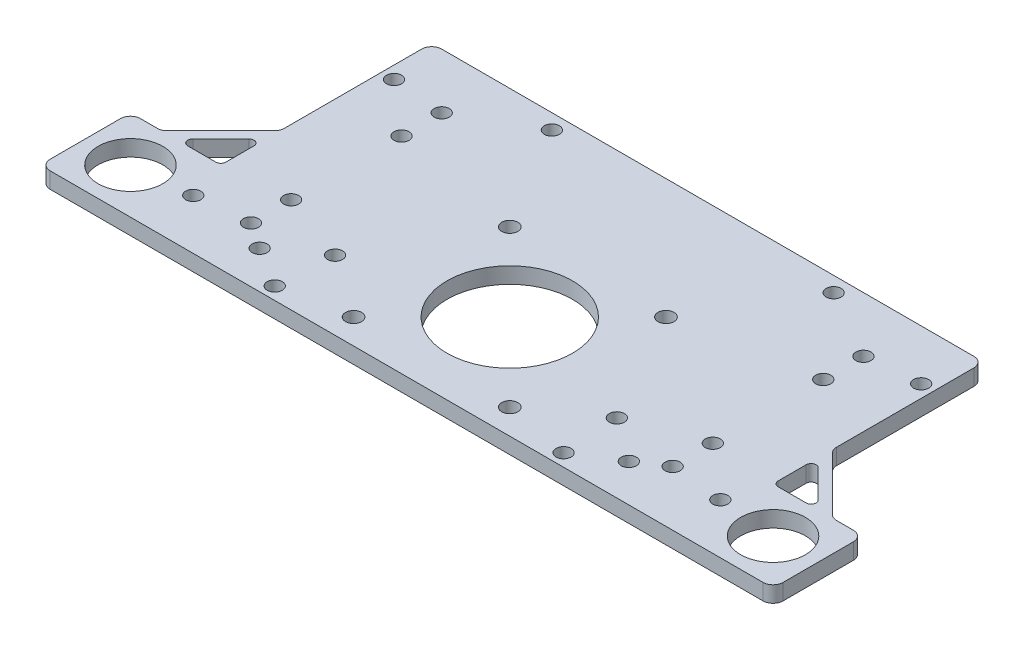
from build123d import *

# Parameters (mm, degrees)
EXTRUDE_1_DEPTH     = 3.2
SKETCH_2_R          = 12.5
SKETCH_2_R_2        = 1.6
SKETCH_2_R_3        = 1.5
SKETCH_2_R_4        = 6.45
CUT_EXTRUDE_1_DEPTH = 3.2
FILLET_1_R          = 2
FILLET_2_R          = 1


# Read off the part's stored shape, not the designer's step: 凸台-拉伸1
with BuildPart() as part:
    # 凸台-拉伸1 outline → 凸台-拉伸1 (new body)
    with BuildSketch(Plane(origin=(0, 0, 0), x_dir=(1, 0, 0), z_dir=(0, 1, 0))):
        Polygon((-55, -0.171572875), (-66.828427125, -12), (-73, -12), (-73, -30), (73, -30), (73, -12), (66.828427125, -12), (55, -0.171572875), (55, 30), (-55, 30), align=None)
        Polygon((-64, -12), (-55, -3), (-55, -12), align=None, mode=Mode.SUBTRACT)
        Polygon((55, -12), (55, -3), (64, -12), align=None, mode=Mode.SUBTRACT)
    extrude(amount=EXTRUDE_1_DEPTH)

    # 草图2 → 切除-拉伸1 (cut)
    with BuildSketch(Plane(origin=(0, 3.2, 0), x_dir=(1, 0, 0), z_dir=(0, 1, 0))):
        with Locations(Location((0, -9.443650814, 0), (0, 0, 270))):
            Circle(SKETCH_2_R)
        with Locations(Location((15.556349186, -25, 0), (0, 0, 270))):
            Circle(SKETCH_2_R_2)
        with Locations(Location((15.556349186, 6.112698372, 0), (0, 0, 270))):
            Circle(SKETCH_2_R_2)
        with Locations(Location((-15.556349186, 6.112698372, 0), (0, 0, 270))):
            Circle(SKETCH_2_R_2)
        with Locations(Location((-15.556349186, -25, 0), (0, 0, 270))):
            Circle(SKETCH_2_R_2)
        with Locations(Location((-52.5, 20, 0), (0, 0, 270))):
            Circle(SKETCH_2_R_3)
        with Locations(Location((-52.5, -20, 0), (0, 0, 270))):
            Circle(SKETCH_2_R_3)
        with Locations(Location((52.5, -20, 0), (0, 0, 270))):
            Circle(SKETCH_2_R_3)
        with Locations(Location((52.5, 20, 0), (0, 0, 270))):
            Circle(SKETCH_2_R_3)
        with Locations(Location((-64, -21, 0), (0, 0, 270))):
            Circle(SKETCH_2_R_4)
        with Locations(Location((64, -21, 0), (0, 0, 270))):
            Circle(SKETCH_2_R_4)
        with Locations(Location((42, 19, 0), (0, 0, 270))):
            Circle(SKETCH_2_R_3)
        with Locations(Location((42, 11, 0), (0, 0, 270))):
            Circle(SKETCH_2_R_3)
        with Locations(Location((-42, 11, 0), (0, 0, 270))):
            Circle(SKETCH_2_R_3)
        with Locations(Location((-42, 19, 0), (0, 0, 270))):
            Circle(SKETCH_2_R_3)
        with Locations(Location((42, -11, 0), (0, 0, 270))):
            Circle(SKETCH_2_R_3)
        with Locations(Location((42, -19, 0), (0, 0, 270))):
            Circle(SKETCH_2_R_3)
        with Locations(Location((-42, -19, 0), (0, 0, 270))):
            Circle(SKETCH_2_R_3)
        with Locations(Location((-42, -11, 0), (0, 0, 270))):
            Circle(SKETCH_2_R_3)
        with Locations(Location((-28.065, 27, 0), (0, 0, 270))):
            Circle(SKETCH_2_R_3)
        with Locations(Location((28.065, 27, 0), (0, 0, 270))):
            Circle(SKETCH_2_R_3)
        with Locations(Location((-28.065, -16.18, 0), (0, 0, 270))):
            Circle(SKETCH_2_R_3)
        with Locations(Location((28.065, -16.18, 0), (0, 0, 270))):
            Circle(SKETCH_2_R_3)
        with Locations(Location((-28.769, -27.5, 0), (0, 0, 270))):
            Circle(SKETCH_2_R_3)
        with Locations(Location((28.769, -27.5, 0), (0, 0, 270))):
            Circle(SKETCH_2_R_3)
        with Locations(Location((-36.769, -22.5, 0), (0, 0, 270))):
            Circle(SKETCH_2_R_3)
        with Locations(Location((36.769, -22.5, 0), (0, 0, 270))):
            Circle(SKETCH_2_R_3)
    extrude(amount=-CUT_EXTRUDE_1_DEPTH, mode=Mode.SUBTRACT)

    # 圆角1
    fillet_1_edges = [part.edges().sort_by_distance(p)[0] for p in [
        (-66.828427125, 1.6, 12),
        (-55, 1.6, 0.171572875),
        (-55, 1.6, -30),
        (55, 1.6, -30),
        (55, 1.6, 0.171572875),
        (66.828427125, 1.6, 12),
        (73, 1.6, 12),
        (73, 1.6, 30),
        (-73, 1.6, 30),
        (-73, 1.6, 12),
    ]]
    fillet(fillet_1_edges, radius=FILLET_1_R)

    # 圆角2
    fillet_2_edges = [part.edges().sort_by_distance(p)[0] for p in [
        (-64, 1.6, 12),
        (-55, 1.6, 12),
        (-55, 1.6, 3),
        (55, 1.6, 3),
        (55, 1.6, 12),
        (64, 1.6, 12),
    ]]
    fillet(fillet_2_edges, radius=FILLET_2_R)


solid = part.part
